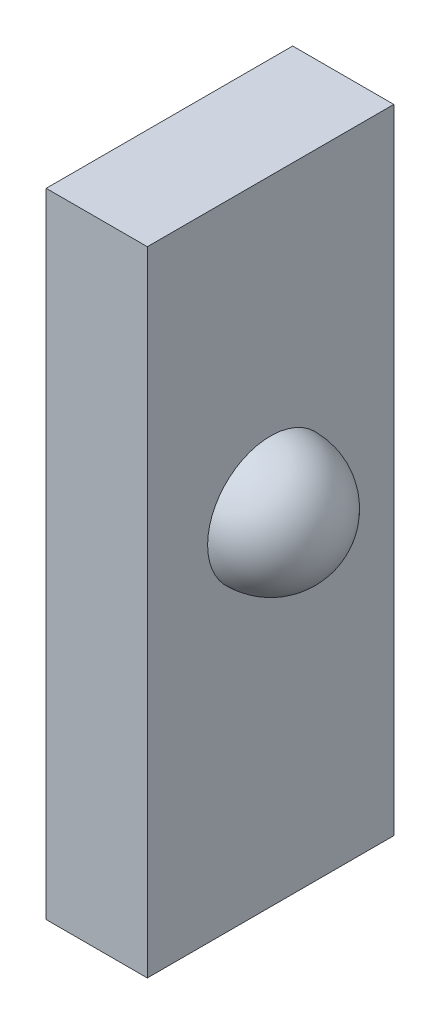
from build123d import *

# Parameters (mm, degrees)
REVOLVE_1_ANGLE            = 180
EXTRUDE_1_DEPTH            = 10
EXTRUDE_1_DEPTH_BACK       = 10
SKETCH_5_W                 = 8.207192737
SKETCH_5_H                 = 51.388558504
PATTERN_LINEAR_1_COUNT     = 2
PATTERN_LINEAR_1_PITCH     = 15
PATTERN_LINEAR_1_COL_COUNT = 2
PATTERN_LINEAR_1_COL_PITCH = 15


with BuildPart() as part:
    # 草图1 → 旋转1 (revolve)
    with BuildSketch(Plane(origin=(0, 0, 0), x_dir=(0, 0, -1), z_dir=(1, 0, 0))):
        with BuildLine():
            Line((0, 5.109354652), (0, -5.109354652))
            ThreePointArc((0, -5.109354652), (5.109354652, 0), (0, 5.109354652))
        make_face()
    revolve(axis=Axis((0, 5.109354652, 0), (0, -1, 0)), revolution_arc=REVOLVE_1_ANGLE)

    # 草图5 → 凸台-拉伸1 (add, two sides: drawn at the far end of the back side and taken through both)
    with BuildSketch(Plane.XY.offset(-EXTRUDE_1_DEPTH_BACK)):
        with Locations((-4.103596368, -2.28630755)):
            Rectangle(SKETCH_5_W, SKETCH_5_H)
    extrude(amount=EXTRUDE_1_DEPTH + EXTRUDE_1_DEPTH_BACK)

    # 草图7 → 切除-旋转1 (revolve, cut)
    with BuildSketch(Plane.XY):
        with BuildLine():
            Line((-8.207192737, 2.927486753), (-8.207192737, -7.500101853))
            ThreePointArc((-8.207192737, -7.500101853), (-13.42098704, -2.28630755), (-8.207192737, 2.927486753))
        make_face()
    cut_revolve_1 = revolve(axis=Axis((-8.207192737, 2.927486753, 0), (0, -1, 0)), mode=Mode.SUBTRACT)

    # 阵列(线性)1: 切除-旋转1 ×2
    with Locations(*[(0, i * PATTERN_LINEAR_1_PITCH, 0) for i in range(1, PATTERN_LINEAR_1_COUNT)]):
        add(cut_revolve_1, mode=Mode.SUBTRACT)

    # 阵列(线性)1 col: 切除-旋转1 ×2
    with Locations(*[(0, -i * PATTERN_LINEAR_1_COL_PITCH, 0) for i in range(1, PATTERN_LINEAR_1_COL_COUNT)]):
        add(cut_revolve_1, mode=Mode.SUBTRACT)


solid = part.part
